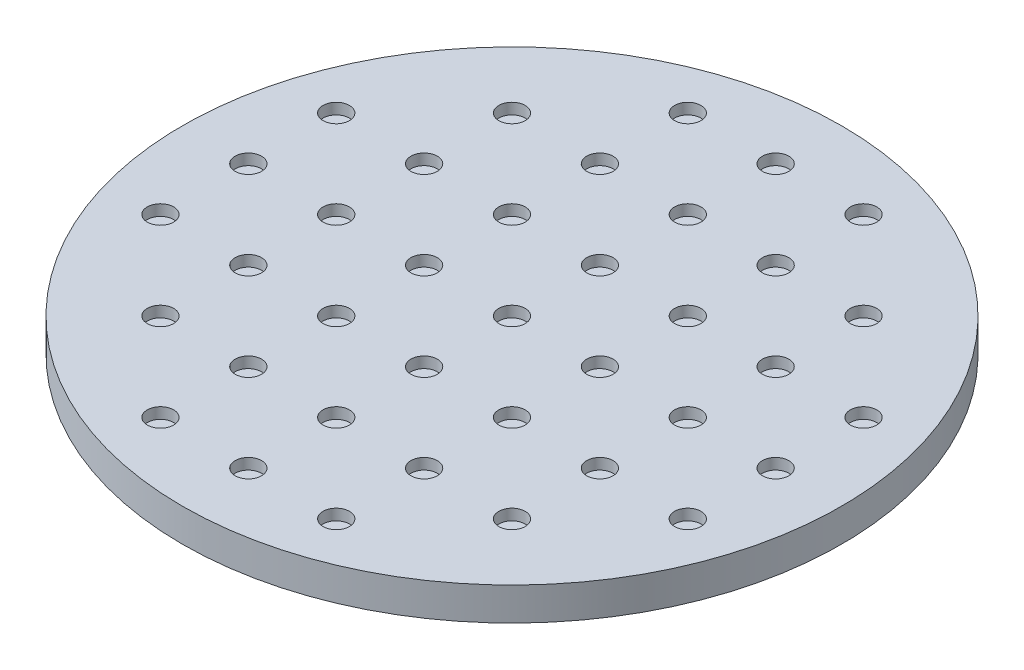
from build123d import *

# Parameters (mm, degrees)
SKETCH1_R           = 381
BOSS_EXTRUDE1_DEPTH = 19.05
SKETCH6_R           = 15.25
CUT_EXTRUDE1_DEPTH  = 12.7


with BuildPart() as part:
    # Sketch1 → Boss-Extrude1 (new, symmetric)
    with BuildSketch(Plane(origin=(0, 0, 0), x_dir=(1, 0, 0), z_dir=(0, 1, 0))):
        Circle(SKETCH1_R)
    extrude(amount=BOSS_EXTRUDE1_DEPTH, both=True)

    # Sketch6 → Cut-Extrude1 (cut)
    with BuildSketch(Plane(origin=(0, 19.05, 0), x_dir=(1, 0, 0), z_dir=(0, 1, 0))):
        Circle(SKETCH6_R)
        with Locations((-101.6, 0)):
            Circle(SKETCH6_R)
        with Locations((101.6, 0)):
            Circle(SKETCH6_R)
        with Locations((-101.6, 101.6)):
            Circle(SKETCH6_R)
        with Locations((0, 101.6)):
            Circle(SKETCH6_R)
        with Locations((101.6, 101.6)):
            Circle(SKETCH6_R)
        with Locations((-101.6, -101.6)):
            Circle(SKETCH6_R)
        with Locations((0, -101.6)):
            Circle(SKETCH6_R)
        with Locations((101.6, -101.6)):
            Circle(SKETCH6_R)
        with Locations((101.6, 203.2)):
            Circle(SKETCH6_R)
        with Locations((0, 203.2)):
            Circle(SKETCH6_R)
        with Locations((-101.6, 203.2)):
            Circle(SKETCH6_R)
        with Locations((101.6, 304.8)):
            Circle(SKETCH6_R)
        with Locations((0, 304.8)):
            Circle(SKETCH6_R)
        with Locations((-101.6, 304.8)):
            Circle(SKETCH6_R)
        with Locations((101.6, -203.2)):
            Circle(SKETCH6_R)
        with Locations((0, -203.2)):
            Circle(SKETCH6_R)
        with Locations((-101.6, -203.2)):
            Circle(SKETCH6_R)
        with Locations((101.6, -304.8)):
            Circle(SKETCH6_R)
        with Locations((0, -304.8)):
            Circle(SKETCH6_R)
        with Locations((-101.6, -304.8)):
            Circle(SKETCH6_R)
        with Locations((203.2, -101.6)):
            Circle(SKETCH6_R)
        with Locations((203.2, 0)):
            Circle(SKETCH6_R)
        with Locations((203.2, 101.6)):
            Circle(SKETCH6_R)
        with Locations((304.8, -101.6)):
            Circle(SKETCH6_R)
        with Locations((304.8, 0)):
            Circle(SKETCH6_R)
        with Locations((304.8, 101.6)):
            Circle(SKETCH6_R)
        with Locations((-203.2, 101.6)):
            Circle(SKETCH6_R)
        with Locations((-203.2, 0)):
            Circle(SKETCH6_R)
        with Locations((-203.2, -101.6)):
            Circle(SKETCH6_R)
        with Locations((-304.8, 101.6)):
            Circle(SKETCH6_R)
        with Locations((-304.8, 0)):
            Circle(SKETCH6_R)
        with Locations((-304.8, -101.6)):
            Circle(SKETCH6_R)
        with Locations((-203.2, 203.2)):
            Circle(SKETCH6_R)
        with Locations((203.2, 203.2)):
            Circle(SKETCH6_R)
        with Locations((203.2, -203.2)):
            Circle(SKETCH6_R)
        with Locations((-203.2, -203.2)):
            Circle(SKETCH6_R)
    extrude(amount=-CUT_EXTRUDE1_DEPTH, mode=Mode.SUBTRACT)


solid = part.part
